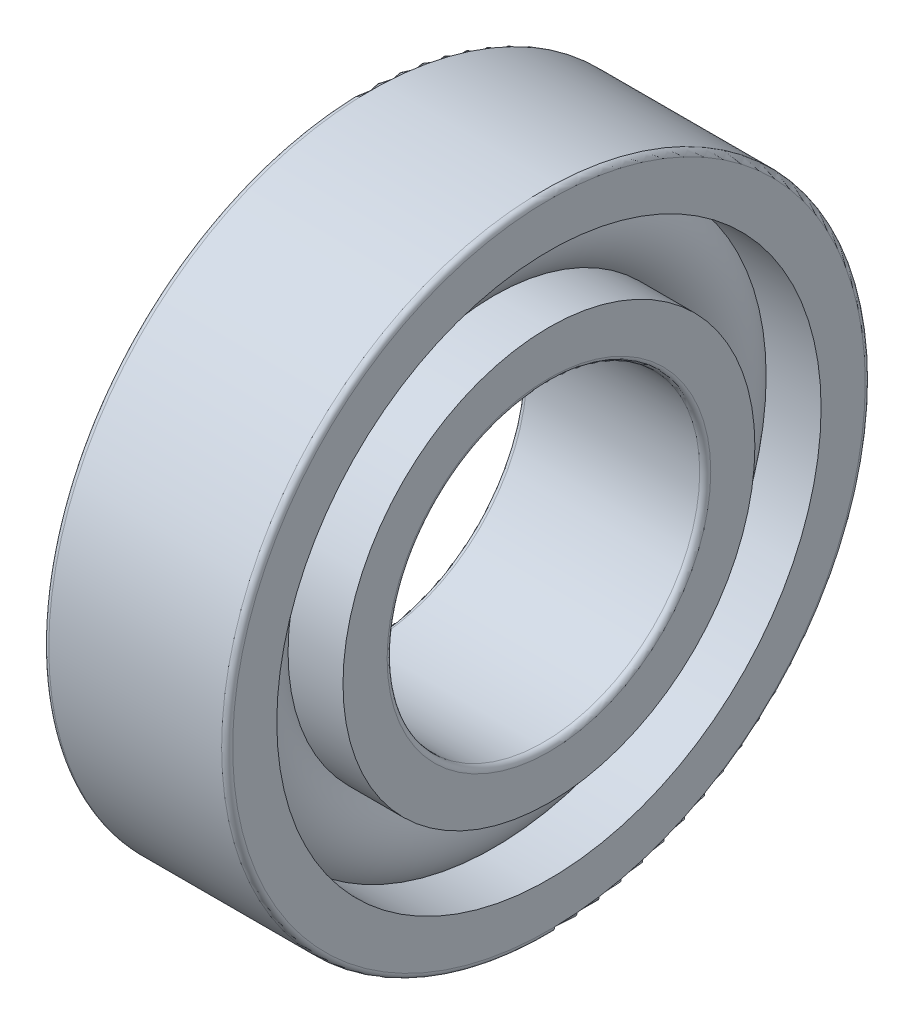
from build123d import *

# Parameters (mm, degrees)
CAGSPISKE_W     = 0.54
CAGSPISKE_H     = 0.9
CAGESPINE_ANGLE = 0.001
BALSIMSKE_R     = 2.7


with BuildPart() as part:
    # CagSpiSke → CageSpine (revolve)
    with BuildSketch(Plane.XY):
        with Locations((0, 13)):
            Rectangle(CAGSPISKE_W, CAGSPISKE_H)
    revolve(axis=Axis((-20.6375, 0, 0), (-1, 0, 0)), revolution_arc=CAGESPINE_ANGLE)

    # BalSimSke → BallsSimplified (revolve)
    with BuildSketch(Plane.XY):
        with Locations((0, 13)):
            Circle(BALSIMSKE_R)
    revolve(axis=Axis((-10, 0, 0), (1, 0, 0)))

    # InnRacSke → InnerRace (revolve)
    with BuildSketch(Plane.XY):
        with BuildLine():
            Line((-1.978793825, 11.2), (-5, 11.2))
            Line((-5, 11.2), (-5, 8.8))
            ThreePointArc((-5, 8.8), (-4.912132034, 8.587867966), (-4.7, 8.5))
            Line((-4.7, 8.5), (4.7, 8.5))
            ThreePointArc((4.7, 8.5), (4.912132034, 8.587867966), (5, 8.8))
            Line((5, 8.8), (5, 11.2))
            Line((5, 11.2), (1.978793825, 11.2))
            ThreePointArc((1.978793825, 11.2), (0, 10.325), (-1.978793825, 11.2))
        make_face()
    revolve(axis=Axis((-20.6375, 0, 0), (1, 0, 0)))

    # OutRacSke → OuterRace (revolve)
    with BuildSketch(Plane.XY):
        with BuildLine():
            Line((-1.978793825, 14.8), (-5, 14.8))
            Line((-5, 14.8), (-5, 17.2))
            ThreePointArc((-5, 17.2), (-4.912132034, 17.412132034), (-4.7, 17.5))
            Line((-4.7, 17.5), (4.7, 17.5))
            ThreePointArc((4.7, 17.5), (4.912132034, 17.412132034), (5, 17.2))
            Line((5, 17.2), (5, 14.8))
            Line((5, 14.8), (1.978793825, 14.8))
            ThreePointArc((1.978793825, 14.8), (0, 15.675), (-1.978793825, 14.8))
        make_face()
    revolve(axis=Axis((-20.6375, 0, 0), (1, 0, 0)))


solid = part.part
